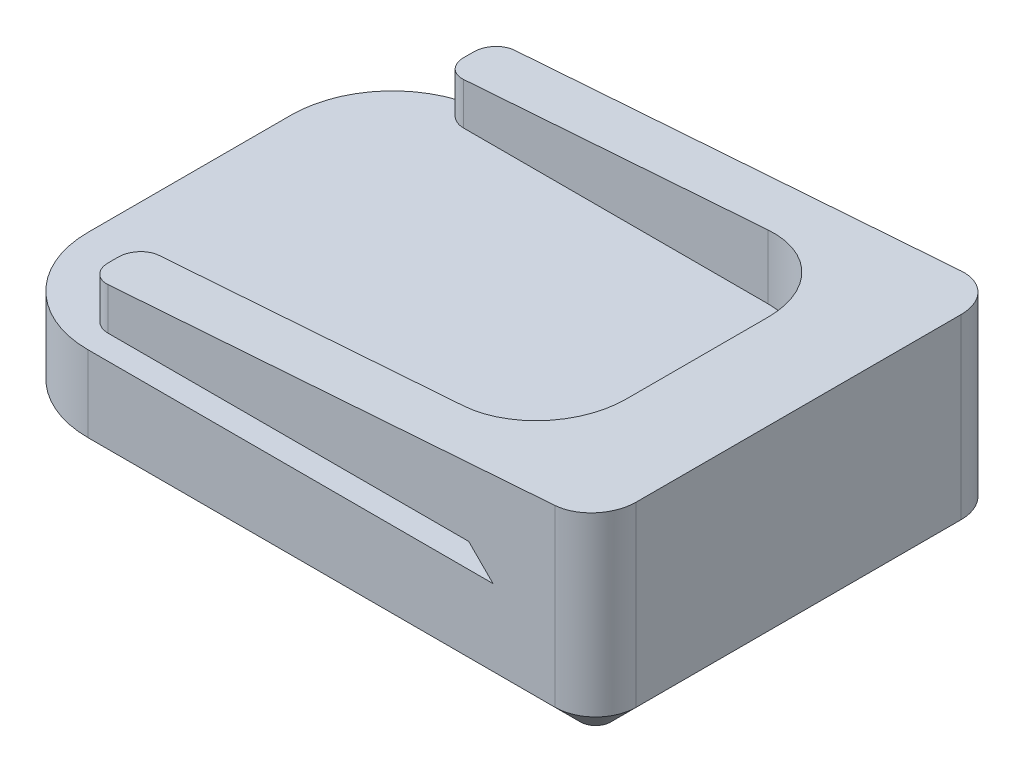
from build123d import *

# Parameters (mm, degrees)
BOSS_EXTRUDE1_DEPTH = 12.7
SKETCH2_W           = 19.05
SKETCH2_H           = 6.35
CUT_EXTRUDE1_DEPTH  = 31.75
CUT_EXTRUDE2_DEPTH  = 35.195796525
CHAMFER3_SIZE       = 1.5875
FILLET1_R           = 1.27
FILLET2_R           = 5.08


with BuildPart() as part:
    # Sketch1 → Boss-Extrude1 (new body)
    with BuildSketch(Plane(origin=(0, 0, 0), x_dir=(1, 0, 0), z_dir=(0, 1, 0))):
        with BuildLine():
            Line((-12.7, -12.7), (16.51, -12.7))
            ThreePointArc((16.51, -12.7), (18.306051224, -11.956051224), (19.05, -10.16))
            Line((19.05, -10.16), (19.05, 10.16))
            ThreePointArc((19.05, 10.16), (18.306051224, 11.956051224), (16.51, 12.7))
            Line((16.51, 12.7), (-12.7, 12.7))
            ThreePointArc((-12.7, 12.7), (-17.190128061, 10.840128061), (-19.05, 6.35))
            Line((-19.05, 6.35), (-19.05, -6.35))
            ThreePointArc((-19.05, -6.35), (-17.190128061, -10.840128061), (-12.7, -12.7))
        make_face()
    extrude(amount=BOSS_EXTRUDE1_DEPTH)

    # Sketch2 → Cut-Extrude1 (cut)
    with BuildSketch(Plane.ZY.offset(19.05)):
        with Locations((0, 9.525)):
            Rectangle(SKETCH2_W, SKETCH2_H)
    extrude(amount=-CUT_EXTRUDE1_DEPTH, mode=Mode.SUBTRACT)

    # Sketch3 → Cut-Extrude2 (cut, through all)
    with BuildSketch(Plane.XY.offset(12.7)):
        Polygon((19.05, 12.7), (-19.05, 12.7), (-19.05, 6.35), (12.065, 6.35), (12.7, 6.35), (12.7, 6.985), (12.7, 7.239), (12.7, 7.874), (12.065, 7.874), (-12.7, 7.874), (-12.7, 10.414), align=None)
    extrude(amount=-CUT_EXTRUDE2_DEPTH, mode=Mode.SUBTRACT)

    # Chamfer3
    # the kernel refuses this chamfer: 1.5875 mm, written as the material it adds along each edge
    with BuildSketch(Plane(origin=(12.7, 7.874, 12.7), x_dir=(0.027495876610588915, -0.9996219169112966, 0), z_dir=(0, 0, -1))) as chamfer3_piece_1:
        Polygon((CHAMFER3_SIZE * 0.999621916911, CHAMFER3_SIZE * 0.0274958766106), (-CHAMFER3_SIZE * 0.0274958766106, CHAMFER3_SIZE * 0.999621916911), (0, 0), align=None)
    extrude(amount=3.175)
    with BuildSketch(Plane(origin=(12.7, 7.874, -9.525), x_dir=(-0.9996219169112968, 0.027495876610586185, 0), z_dir=(0, 0, -1))) as chamfer3_piece_2:
        Polygon((CHAMFER3_SIZE * 0.999621916911, -CHAMFER3_SIZE * 0.0274958766106), (-CHAMFER3_SIZE * 0.0274958766106, -CHAMFER3_SIZE * 0.999621916911), (0, 0), align=None)
    extrude(amount=3.175)
    # the kernel refuses this chamfer: 1.5875 mm, written as the material it takes off along each edge
    with BuildSketch(Plane(origin=(-12.7, 0, 12.7), x_dir=(0, 0.9996219169112966, 0.027495876610586743), z_dir=(1, 0, 0)), Plane(origin=(16.51, 0, -12.7), x_dir=(0, 0.9996219169112966, -0.027495876610586743), z_dir=(-1, 0, 0))) as chamfer3_2_piece_1:
        Polygon((CHAMFER3_SIZE * 0.999621916911, -CHAMFER3_SIZE * 0.0274958766106), (-CHAMFER3_SIZE * 0.0274958766106, -CHAMFER3_SIZE * 0.999621916911), (0, 0), align=None)
    extrude(amount=29.21, mode=Mode.SUBTRACT)
    with BuildSketch(Plane(origin=(16.51, 0, 10.16), x_dir=(0, 0, 1), z_dir=(-1, 0, 0))) as chamfer3_2_piece_2:
        Polygon((2.54 - CHAMFER3_SIZE, 0), (2.54, CHAMFER3_SIZE), (2.54, 0), align=None)
    revolve(axis=Axis((16.51, 0, 10.16), (0, 1, 0)), revolution_arc=90, mode=Mode.SUBTRACT)
    with BuildSketch(Plane(origin=(19.05, 0, 10.16), x_dir=(0.027495876610585654, 0.9996219169112966, 0), z_dir=(0, 0, -1))) as chamfer3_2_piece_3:
        Polygon((CHAMFER3_SIZE * 0.999621916911, -CHAMFER3_SIZE * 0.0274958766106), (-CHAMFER3_SIZE * 0.0274958766106, -CHAMFER3_SIZE * 0.999621916911), (0, 0), align=None)
    extrude(amount=20.32, mode=Mode.SUBTRACT)
    with BuildSketch(Plane(origin=(16.51, 0, -10.16), x_dir=(1, 0, 0), z_dir=(0, 0, 1))) as chamfer3_2_piece_4:
        Polygon((2.54, CHAMFER3_SIZE), (2.54 - CHAMFER3_SIZE, 0), (2.54, 0), align=None)
    revolve(axis=Axis((16.51, 0, -10.16), (0, 1, 0)), revolution_arc=90, mode=Mode.SUBTRACT)
    with BuildSketch(Plane(origin=(-12.7, 0, -6.35), x_dir=(0, 0, -1), z_dir=(1, 0, 0))) as chamfer3_2_piece_5:
        Polygon((6.35, CHAMFER3_SIZE), (6.35 - CHAMFER3_SIZE, 0), (6.35, 0), align=None)
    revolve(axis=Axis((-12.7, 0, -6.35), (0, 1, 0)), revolution_arc=90, mode=Mode.SUBTRACT)
    with BuildSketch(Plane(origin=(-12.7, 0, 6.35), x_dir=(-1, 0, 0), z_dir=(0, 0, -1))) as chamfer3_2_piece_6:
        Polygon((6.35, CHAMFER3_SIZE), (6.35 - CHAMFER3_SIZE, 0), (6.35, 0), align=None)
    revolve(axis=Axis((-12.7, 0, 6.35), (0, 1, 0)), revolution_arc=90, mode=Mode.SUBTRACT)
    with BuildSketch(Plane(origin=(-19.05, 0, -6.35), x_dir=(-0.027495876610585654, 0.9996219169112966, 0), z_dir=(0, 0, 1))) as chamfer3_2_piece_7:
        Polygon((CHAMFER3_SIZE * 0.999621916911, -CHAMFER3_SIZE * 0.0274958766106), (-CHAMFER3_SIZE * 0.0274958766106, -CHAMFER3_SIZE * 0.999621916911), (0, 0), align=None)
    extrude(amount=12.7, mode=Mode.SUBTRACT)

    # Fillet1
    fillet1_edges = [part.edges().sort_by_distance(p)[0] for p in [
        (-12.7, 9.144, -9.525),
        (-12.7, 9.144, 9.525),
        (-12.7, 9.144, -12.7),
        (-12.7, 9.144, 12.7),
    ]]
    fillet(fillet1_edges, radius=FILLET1_R)

    # Fillet2
    fillet2_edges = [part.edges().sort_by_distance(p)[0] for p in [
        (12.7, 9.2964, -9.525),
        (12.7, 9.2964, 9.525),
    ]]
    fillet(fillet2_edges, radius=FILLET2_R)


solid = part.part
